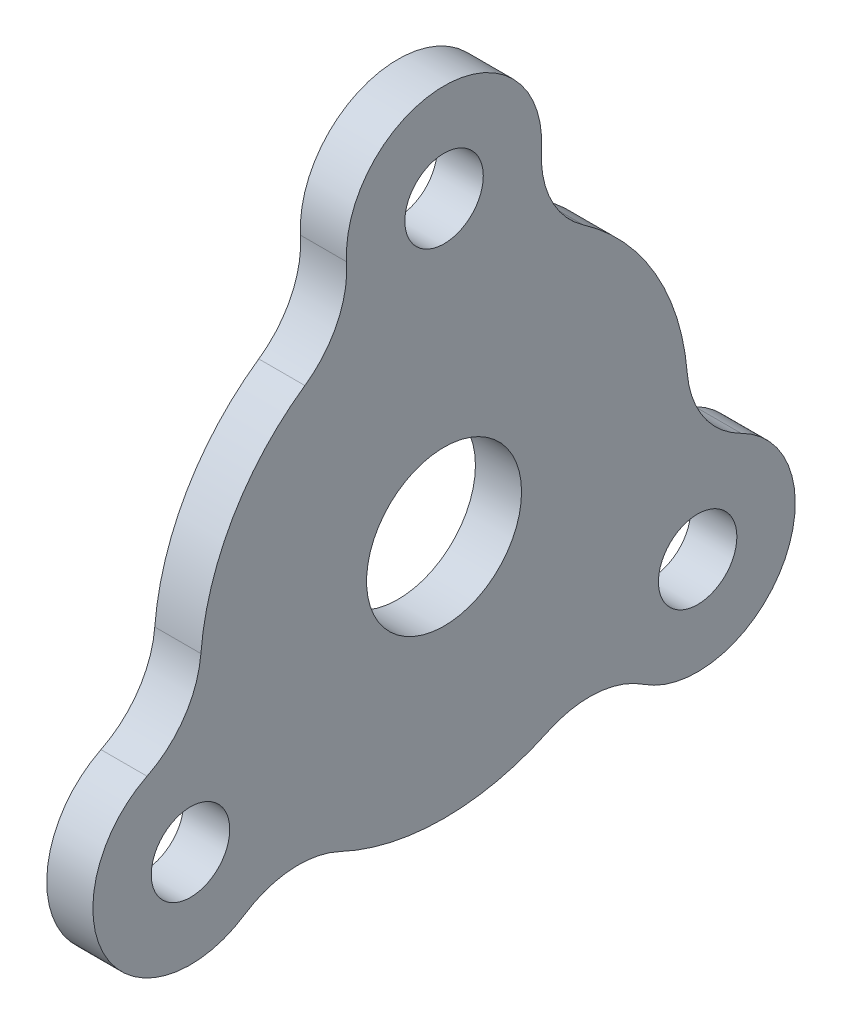
from build123d import *

# Parameters (mm, degrees)
SKETCH1_R               = 2.5527
BOSS_EXTRUDE1_DEPTH     = 3
F_3_8_CLEARANCE_HOLE1_D = 10.0838


with BuildPart() as part:
    # Sketch1 → Boss-Extrude1 (new body)
    with BuildSketch(Plane(origin=(0, 0, 0), x_dir=(0, 0, -1), z_dir=(1, 0, 0))):
        with BuildLine():
            ThreePointArc((-9.053693601, 13.040178571), (-13.748153285, 7.9375), (-15.819972713, 1.320639371))
            ThreePointArc((-15.819972713, 1.320639371), (-16.894607196, -1.718283796), (-19.32287287, -3.83805244))
            ThreePointArc((-19.32287287, -3.83805244), (-21.997045256, -12.7), (-12.98528735, -14.81507256))
            ThreePointArc((-12.98528735, -14.81507256), (-9.935381017, -13.77201712), (-6.766279112, -14.360817942))
            ThreePointArc((-6.766279112, -14.360817942), (0, -15.875), (6.766279112, -14.360817942))
            ThreePointArc((6.766279112, -14.360817942), (9.935381017, -13.77201712), (12.98528735, -14.81507256))
            ThreePointArc((12.98528735, -14.81507256), (21.997045256, -12.7), (19.32287287, -3.83805244))
            ThreePointArc((19.32287287, -3.83805244), (16.894607196, -1.718283796), (15.819972713, 1.320639371))
            ThreePointArc((15.819972713, 1.320639371), (13.748153285, 7.9375), (9.053693601, 13.040178571))
            ThreePointArc((9.053693601, 13.040178571), (6.959226179, 15.490300917), (6.337585521, 18.653125))
            ThreePointArc((6.337585521, 18.653125), (0, 25.4), (-6.337585521, 18.653125))
            ThreePointArc((-6.337585521, 18.653125), (-6.959226179, 15.490300917), (-9.053693601, 13.040178571))
        make_face()
        with Locations((0, 19.05)):
            Circle(SKETCH1_R, mode=Mode.SUBTRACT)
        with Locations((-16.497783942, -9.525)):
            Circle(SKETCH1_R, mode=Mode.SUBTRACT)
        with Locations((16.497783942, -9.525)):
            Circle(SKETCH1_R, mode=Mode.SUBTRACT)
    extrude(amount=BOSS_EXTRUDE1_DEPTH)

    # 3/8 Clearance Hole1 (through all)
    with Locations(Plane(origin=(3, 0, 0), x_dir=(0, 0, -1), z_dir=(1, 0, 0))):
        with Locations((0, 0)):
            Hole(F_3_8_CLEARANCE_HOLE1_D / 2)


solid = part.part
